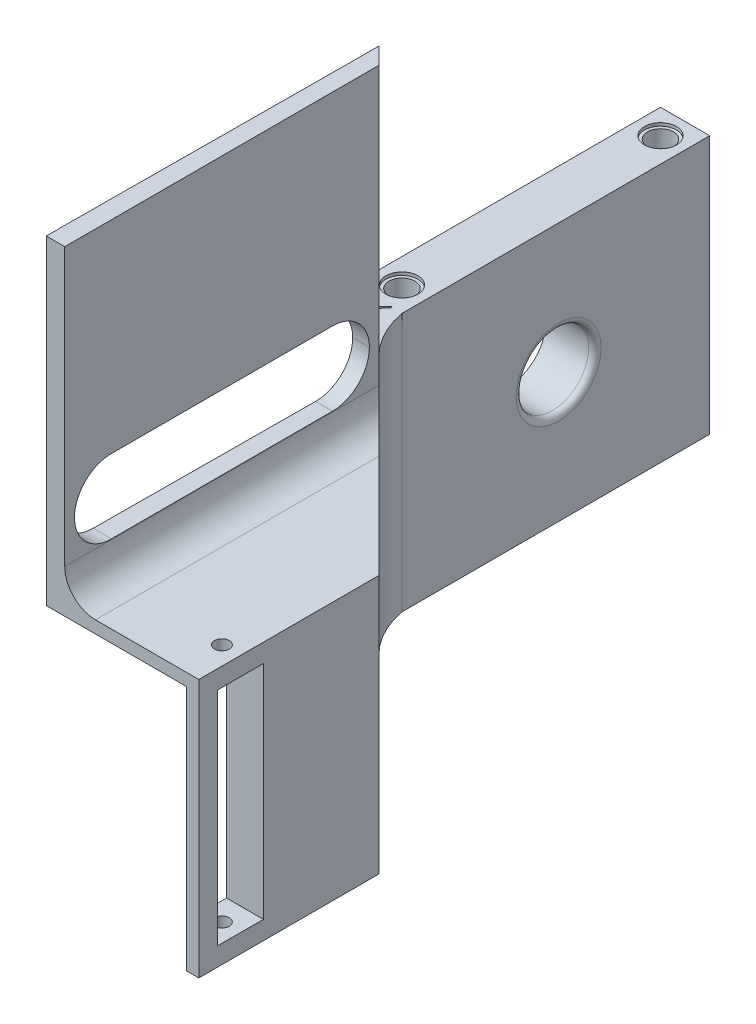
from build123d import *

# Parameters (mm, degrees)
SKETCH1_W           = 25
SKETCH1_H           = 50
SKETCH1_R           = 3.4
BOSS_EXTRUDE1_DEPTH = 3
SKETCH2_W           = 50
SKETCH2_H           = 3
BOSS_EXTRUDE2_DEPTH = 8
SKETCH3_W           = 8
SKETCH3_H           = 50
BOSS_EXTRUDE3_DEPTH = 42
SKETCH4_R           = 2.65
CUT_EXTRUDE1_DEPTH  = 0.5
SKETCH5_R           = 5.888972746
CUT_EXTRUDE2_DEPTH  = 9
FILLET2_R           = 1
SKETCH6_R           = 12.6
BOSS_EXTRUDE4_DEPTH = 2
FILLET4_R           = 1
SKETCH8_R           = 1.589780168
SKETCH8_R_2         = 1.777428262
CUT_EXTRUDE3_DEPTH  = 10
SKETCH9_W           = 49.021678163
SKETCH9_H           = 20.976854622
CUT_EXTRUDE4_DEPTH  = 68.79439129
SKETCH11_R          = 2.1
CUT_EXTRUDE5_DEPTH  = 59.480168703
SKETCH14_R          = 2.6
CUT_EXTRUDE6_DEPTH  = 0.5
BOSS_EXTRUDE5_DEPTH = 42
FILLET5_R           = 15
BOSS_EXTRUDE6_DEPTH = 42
SKETCH18_W          = 7.5
SKETCH18_H          = 36
CUT_EXTRUDE7_DEPTH  = 8
SKETCH19_R          = 1.2
CUT_EXTRUDE8_DEPTH  = 96.073366415
FILL_START          = -24.41711757
FILL_PATTERN1_DEPTH = 4.904046836
CHAMFER1_SIZE       = 4
CUT_EXTRUDE9_DEPTH  = 96.073366415
BOSS_EXTRUDE7_DEPTH = 2
BOSS_EXTRUDE8_DEPTH = 50
BOSS_EXTRUDE9_DEPTH = 4
SKETCH24_W          = 47.897956882
SKETCH24_H          = 12
CUT_EXTRUDE10_DEPTH = 4
FILLET6_R           = 6
FILLET7_R           = 5


# Read off the part's stored shape, not the designer's step: Fill Pattern1
# Some blends are built 0.0001 mm under size
with BuildPart() as part:
    # Sketch1 → Boss-Extrude1 (new body)
    with BuildSketch(Plane(origin=(0, 0, 0), x_dir=(1, 0, 0), z_dir=(0, 1, 0))):
        with Locations((2.276951673, 11.384758364)):
            Rectangle(SKETCH1_W, SKETCH1_H)
        with Locations(Location((1.276951673, 11.384758364, 0), (0, 0, 270))):
            Circle(SKETCH1_R, mode=Mode.SUBTRACT)
    extrude(amount=BOSS_EXTRUDE1_DEPTH)

    # Sketch2 → Boss-Extrude2 (add)
    with BuildSketch(Plane.ZY.offset(10.223048327)):
        with Locations((-11.384758364, 1.5)):
            Rectangle(SKETCH2_W, SKETCH2_H)
    extrude(amount=BOSS_EXTRUDE2_DEPTH)

    # Sketch3 → Boss-Extrude3 (add)
    with BuildSketch(Plane.XZ):
        with Locations((-14.223048327, -11.384758364)):
            Rectangle(SKETCH3_W, SKETCH3_H)
    extrude(amount=BOSS_EXTRUDE3_DEPTH)

    # Sketch4 → Cut-Extrude1 (cut)
    with BuildSketch(Plane(origin=(0, 3, 0), x_dir=(1, 0, 0), z_dir=(0, 1, 0))):
        with Locations(Location((-14.223048327, 32.384758364, 0), (0, 0, 270))):
            Circle(SKETCH4_R)
        with Locations(Location((-14.223048327, -9.615241636, 0), (0, 0, 270))):
            Circle(SKETCH4_R)
    cut_extrude1 = extrude(amount=-CUT_EXTRUDE1_DEPTH, mode=Mode.SUBTRACT)

    # Mirror1: Cut-Extrude1 across plane
    add(cut_extrude1.mirror(Plane.ZX.offset(-19.5)), mode=Mode.SUBTRACT)

    # Sketch5 → Cut-Extrude2 (cut)
    with BuildSketch(Plane.ZY.offset(18.223048327)):
        with Locations((-11.836279124, -21)):
            Circle(SKETCH5_R)
    extrude(amount=-CUT_EXTRUDE2_DEPTH, mode=Mode.SUBTRACT)

    # Fillet2
    fillet2_edges = [part.edges().sort_by_distance(p)[0] for p in [
        (-10.223048327, -21, -17.72525187),
    ]]
    fillet(fillet2_edges, radius=FILLET2_R)

    # Mirror2: Cut-Extrude1 across plane
    add(cut_extrude1.mirror(Plane.ZY.offset(1.723048327)), mode=Mode.SUBTRACT)

    # Sketch6 → Boss-Extrude4 (add)
    with BuildSketch(Plane(origin=(0, 3, 0), x_dir=(1, 0, 0), z_dir=(0, 1, 0))):
        with BuildLine():
            Line((14.776951673, 5.825082115), (14.776951673, 16.944434614))
            ThreePointArc((14.776951673, 16.944434614), (-13.323048327, 11.384758364), (14.776951673, 5.825082115))
        make_face()
        with Locations(Location((1.276951673, 11.384758364, 0), (0, 0, 270))):
            Circle(SKETCH6_R, mode=Mode.SUBTRACT)
    extrude(amount=BOSS_EXTRUDE4_DEPTH)

    # Fillet4
    # the kernel refuses this fillet: 1 mm, written as the material it takes off along each edge
    with BuildSketch(Plane(origin=(14.776951673, 5, -3.325082115), x_dir=(0, -1, 0), z_dir=(0, 0, -1))) as fillet4_piece_1:
        with BuildLine():
            CenterArc((FILLET4_R, FILLET4_R), FILLET4_R, 180, 90)
            Line((0, FILLET4_R), (0, 0))
            Line((0, 0), (FILLET4_R, 0))
        make_face()
    extrude(amount=16.119352499, mode=Mode.SUBTRACT)

    # Sketch8 → Cut-Extrude3 (cut)
    with BuildSketch(Plane(origin=(0, 3, 0), x_dir=(1, 0, 0), z_dir=(0, 1, 0))):
        with Locations(Location((1.276951673, 19.884758364, 0), (0, 0, 270))):
            Circle(SKETCH8_R)
        with Locations(Location((1.276951673, 2.884758364, 0), (0, 0, 270))):
            Circle(SKETCH8_R_2)
    extrude(amount=-CUT_EXTRUDE3_DEPTH, mode=Mode.SUBTRACT)

    # Sketch9 → Cut-Extrude4 (cut, through all)
    with BuildSketch(Plane.XY.offset(13.615241636)):
        with Locations((-9.733887409, 10.488427311)):
            Rectangle(SKETCH9_W, SKETCH9_H)
    extrude(amount=-CUT_EXTRUDE4_DEPTH, mode=Mode.SUBTRACT)

    # Sketch11 → Cut-Extrude5 (cut, through all)
    with BuildSketch(Plane(origin=(0, 0, 0), x_dir=(1, 0, 0), z_dir=(0, 1, 0))):
        with Locations(Location((-14.223048327, 32.384758364, 0), (0, 0, 270))):
            Circle(SKETCH11_R)
    cut_extrude5 = extrude(amount=-CUT_EXTRUDE5_DEPTH, mode=Mode.SUBTRACT)

    # Mirror3: Cut-Extrude5 across plane
    add(cut_extrude5.mirror(Plane.XY.offset(-11.384758364)), mode=Mode.SUBTRACT)

    # Sketch14 → Cut-Extrude6 (cut)
    with BuildSketch(Plane(origin=(0, 0, 0), x_dir=(1, 0, 0), z_dir=(0, 1, 0))):
        with Locations(Location((-14.223048327, -9.615241636, 0), (0, 0, 270))):
            Circle(SKETCH14_R)
    cut_extrude6 = extrude(amount=-CUT_EXTRUDE6_DEPTH, mode=Mode.SUBTRACT)

    # Mirror4: Cut-Extrude6 across plane
    add(cut_extrude6.mirror(Plane.XY.offset(-11.384758364)), mode=Mode.SUBTRACT)

    # Sketch16 → Boss-Extrude5 (add)
    with BuildSketch(Plane(origin=(0, 0, 0), x_dir=(1, 0, 0), z_dir=(0, 1, 0))):
        Polygon((-18.223048327, -13.615241636), (24.776951673, -56.615241636), (24.776951673, -52.372600949), (-13.98040764, -13.615241636), align=None)
    extrude(amount=-BOSS_EXTRUDE5_DEPTH)

    # Fillet5
    # the kernel refuses this fillet: 15 mm, written as the material it adds along each edge
    with BuildSketch(Plane(origin=(-13.98040764, 0, 13.615241636), x_dir=(1, 0, 0), z_dir=(0, -1, 0))) as fillet5_piece_1:
        with BuildLine():
            CenterArc((18.512169169, -2.701034267), FILLET5_R, 135, 34.626223963)
            Line((7.905567451, 7.905567451), (0, 0))
            Line((0, 0), (3.757359313, 0))
        make_face()
    extrude(amount=42)

    # Sketch17 → Boss-Extrude6 (add)
    with BuildSketch(Plane(origin=(0, 0, 0), x_dir=(1, 0, 0), z_dir=(0, 1, 0))):
        Polygon((24.776951673, -56.615241636), (24.776951673, -81.615241636), (18.776951673, -81.615241636), (18.776951673, -50.615241636), align=None)
    extrude(amount=-BOSS_EXTRUDE6_DEPTH)

    # Sketch18 → Cut-Extrude7 (cut)
    with BuildSketch(Plane(origin=(24.776951673, 0, 0), x_dir=(0, 0, -1), z_dir=(1, 0, 0))):
        with Locations((-74.865241636, -21)):
            Rectangle(SKETCH18_W, SKETCH18_H)
    extrude(amount=-CUT_EXTRUDE7_DEPTH, mode=Mode.SUBTRACT)

    # Sketch19 → Cut-Extrude8 (cut, through all)
    with BuildSketch(Plane(origin=(0, 0, 0), x_dir=(1, 0, 0), z_dir=(0, 1, 0))):
        with Locations(Location((21.776951673, -74.865241636, 0), (0, 0, 270))):
            Circle(SKETCH19_R)
    extrude(amount=-CUT_EXTRUDE8_DEPTH, mode=Mode.SUBTRACT)

    # Fill Pattern1 outline → Fill Pattern1 (cut)
    with BuildSketch(Plane(origin=(0, 0, 0), x_dir=(0.7071067811865468, 0, 0.7071067811865482), z_dir=(0.7071067811865481, 0, -0.707106781186547)).offset(FILL_START)):
        Polygon((45.971737286, 5.859685187), (47.221737286, 3.694621678), (49.721737286, 3.694621678), (50.971737286, 5.859685187), (49.721737286, 8.024748697), (47.221737286, 8.024748697), align=None)
        Polygon((30.237460587, 33.11225185), (31.487460587, 30.947188341), (33.987460587, 30.947188341), (35.237460587, 33.11225185), (33.987460587, 35.27731536), (31.487460587, 35.27731536), align=None)
        Polygon((40.726978386, 14.943874075), (41.976978386, 12.778810565), (44.476978386, 12.778810565), (45.726978386, 14.943874075), (44.476978386, 17.108937584), (41.976978386, 17.108937584), align=None)
        Polygon((35.482219487, 24.028062963), (36.732219487, 21.862999453), (39.232219487, 21.862999453), (40.482219487, 24.028062963), (39.232219487, 26.193126472), (36.732219487, 26.193126472), align=None)
        Polygon((15.753183888, 3.694621678), (18.253183888, 3.694621678), (19.503183888, 5.859685187), (18.253183888, 8.024748697), (15.753183888, 8.024748697), (14.503183888, 5.859685187), align=None)
        Polygon((26.242701687, 3.694621678), (28.742701687, 3.694621678), (29.992701687, 5.859685187), (28.742701687, 8.024748697), (26.242701687, 8.024748697), (24.992701687, 5.859685187), align=None)
        Polygon((36.732219487, 3.694621678), (39.232219487, 3.694621678), (40.482219487, 5.859685187), (39.232219487, 8.024748697), (36.732219487, 8.024748697), (35.482219487, 5.859685187), align=None)
        Polygon((45.971737286, 11.915811112), (47.221737286, 9.750747603), (49.721737286, 9.750747603), (50.971737286, 11.915811112), (49.721737286, 14.080874622), (47.221737286, 14.080874622), align=None)
        Polygon((40.726978386, 21), (41.976978386, 18.834936491), (44.476978386, 18.834936491), (45.726978386, 21), (44.476978386, 23.165063509), (41.976978386, 23.165063509), align=None)
        Polygon((35.482219487, 30.084188888), (36.732219487, 27.919125378), (39.232219487, 27.919125378), (40.482219487, 30.084188888), (39.232219487, 32.249252397), (36.732219487, 32.249252397), align=None)
        Polygon((15.753183888, 9.750747603), (18.253183888, 9.750747603), (19.503183888, 11.915811112), (18.253183888, 14.080874622), (15.753183888, 14.080874622), (14.503183888, 11.915811112), align=None)
        Polygon((26.242701687, 9.750747603), (28.742701687, 9.750747603), (29.992701687, 11.915811112), (28.742701687, 14.080874622), (26.242701687, 14.080874622), (24.992701687, 11.915811112), align=None)
        Polygon((36.732219487, 9.750747603), (39.232219487, 9.750747603), (40.482219487, 11.915811112), (39.232219487, 14.080874622), (36.732219487, 14.080874622), (35.482219487, 11.915811112), align=None)
        Polygon((45.971737286, 17.971937037), (47.221737286, 15.806873528), (49.721737286, 15.806873528), (50.971737286, 17.971937037), (49.721737286, 20.137000547), (47.221737286, 20.137000547), align=None)
        Polygon((40.726978386, 27.056125925), (41.976978386, 24.891062416), (44.476978386, 24.891062416), (45.726978386, 27.056125925), (44.476978386, 29.221189435), (41.976978386, 29.221189435), align=None)
        Polygon((35.482219487, 36.140314813), (36.732219487, 33.975251303), (39.232219487, 33.975251303), (40.482219487, 36.140314813), (39.232219487, 38.305378322), (36.732219487, 38.305378322), align=None)
        Polygon((15.753183888, 15.806873528), (18.253183888, 15.806873528), (19.503183888, 17.971937037), (18.253183888, 20.137000547), (15.753183888, 20.137000547), (14.503183888, 17.971937037), align=None)
        Polygon((26.242701687, 15.806873528), (28.742701687, 15.806873528), (29.992701687, 17.971937037), (28.742701687, 20.137000547), (26.242701687, 20.137000547), (24.992701687, 17.971937037), align=None)
        Polygon((36.732219487, 15.806873528), (39.232219487, 15.806873528), (40.482219487, 17.971937037), (39.232219487, 20.137000547), (36.732219487, 20.137000547), (35.482219487, 17.971937037), align=None)
        Polygon((44.476978386, 6.72268464), (45.726978386, 8.88774815), (44.476978386, 11.052811659), (41.976978386, 11.052811659), (40.726978386, 8.88774815), (41.976978386, 6.72268464), align=None)
        Polygon((45.971737286, 24.028062963), (47.221737286, 21.862999453), (49.721737286, 21.862999453), (50.971737286, 24.028062963), (49.721737286, 26.193126472), (47.221737286, 26.193126472), align=None)
        Polygon((40.726978386, 33.11225185), (41.976978386, 30.947188341), (44.476978386, 30.947188341), (45.726978386, 33.11225185), (44.476978386, 35.27731536), (41.976978386, 35.27731536), align=None)
        Polygon((15.753183888, 21.862999453), (18.253183888, 21.862999453), (19.503183888, 24.028062963), (18.253183888, 26.193126472), (15.753183888, 26.193126472), (14.503183888, 24.028062963), align=None)
        Polygon((26.242701687, 21.862999453), (28.742701687, 21.862999453), (29.992701687, 24.028062963), (28.742701687, 26.193126472), (26.242701687, 26.193126472), (24.992701687, 24.028062963), align=None)
        Polygon((45.971737286, 36.140314813), (47.221737286, 33.975251303), (49.721737286, 33.975251303), (50.971737286, 36.140314813), (49.721737286, 38.305378322), (47.221737286, 38.305378322), align=None)
        Polygon((15.753183888, 33.975251303), (18.253183888, 33.975251303), (19.503183888, 36.140314813), (18.253183888, 38.305378322), (15.753183888, 38.305378322), (14.503183888, 36.140314813), align=None)
        Polygon((26.242701687, 33.975251303), (28.742701687, 33.975251303), (29.992701687, 36.140314813), (28.742701687, 38.305378322), (26.242701687, 38.305378322), (24.992701687, 36.140314813), align=None)
        Polygon((33.987460587, 6.72268464), (35.237460587, 8.88774815), (33.987460587, 11.052811659), (31.487460587, 11.052811659), (30.237460587, 8.88774815), (31.487460587, 6.72268464), align=None)
        Polygon((45.971737286, 30.084188888), (47.221737286, 27.919125378), (49.721737286, 27.919125378), (50.971737286, 30.084188888), (49.721737286, 32.249252397), (47.221737286, 32.249252397), align=None)
        Polygon((15.753183888, 27.919125378), (18.253183888, 27.919125378), (19.503183888, 30.084188888), (18.253183888, 32.249252397), (15.753183888, 32.249252397), (14.503183888, 30.084188888), align=None)
        Polygon((26.242701687, 27.919125378), (28.742701687, 27.919125378), (29.992701687, 30.084188888), (28.742701687, 32.249252397), (26.242701687, 32.249252397), (24.992701687, 30.084188888), align=None)
        Polygon((19.747942788, 27.056125925), (20.997942788, 24.891062416), (23.497942788, 24.891062416), (24.747942788, 27.056125925), (23.497942788, 29.221189435), (20.997942788, 29.221189435), align=None)
        Polygon((19.747942788, 8.88774815), (20.997942788, 6.72268464), (23.497942788, 6.72268464), (24.747942788, 8.88774815), (23.497942788, 11.052811659), (20.997942788, 11.052811659), align=None)
        Polygon((33.987460587, 24.891062416), (35.237460587, 27.056125925), (33.987460587, 29.221189435), (31.487460587, 29.221189435), (30.237460587, 27.056125925), (31.487460587, 24.891062416), align=None)
        Polygon((19.747942788, 14.943874075), (20.997942788, 12.778810565), (23.497942788, 12.778810565), (24.747942788, 14.943874075), (23.497942788, 17.108937584), (20.997942788, 17.108937584), align=None)
        Polygon((31.487460587, 12.778810565), (33.987460587, 12.778810565), (35.237460587, 14.943874075), (33.987460587, 17.108937584), (31.487460587, 17.108937584), (30.237460587, 14.943874075), align=None)
        Polygon((19.747942788, 21), (20.997942788, 18.834936491), (23.497942788, 18.834936491), (24.747942788, 21), (23.497942788, 23.165063509), (20.997942788, 23.165063509), align=None)
        Polygon((31.487460587, 18.834936491), (33.987460587, 18.834936491), (35.237460587, 21), (33.987460587, 23.165063509), (31.487460587, 23.165063509), (30.237460587, 21), align=None)
        Polygon((20.997942788, 30.947188341), (23.497942788, 30.947188341), (24.747942788, 33.11225185), (23.497942788, 35.27731536), (20.997942788, 35.27731536), (19.747942788, 33.11225185), align=None)
    extrude(amount=FILL_PATTERN1_DEPTH, mode=Mode.SUBTRACT)

    # Chamfer1
    # the kernel refuses this chamfer: 4 mm, written as the material it takes off along each edge
    with BuildSketch(Plane(origin=(18.776951673, 10.286731952, 81.615241636), x_dir=(0.9996219169112968, 0, 0.027495876610585623), z_dir=(0, -1, 0))) as chamfer1_piece_1:
        Polygon((CHAMFER1_SIZE * 0.999621916911, -CHAMFER1_SIZE * 0.0274958766106), (-CHAMFER1_SIZE * 0.0274958766106, -CHAMFER1_SIZE * 0.999621916911), (0, 0), align=None)
    extrude(amount=62.573463904, mode=Mode.SUBTRACT)

    # Sketch20 → Cut-Extrude9 (cut, through all)
    with BuildSketch(Plane(origin=(0, 0, 0), x_dir=(1, 0, 0), z_dir=(0, 1, 0))):
        Polygon((-12.007369699, -13.422049918), (-13.646299524, -15.19356362), (-10.796749548, -17.829847178), (-10.525107778, -17.536230508), (-13.131913788, -15.124523438), (-11.876337797, -13.743390342), align=None)
    extrude(amount=-CUT_EXTRUDE9_DEPTH, mode=Mode.SUBTRACT)

    # Sketch21 → Boss-Extrude7 (add)
    with BuildSketch(Plane(origin=(0, 0, 0), x_dir=(1, 0, 0), z_dir=(0, 1, 0))):
        Polygon((18.776951673, -77.615241636), (0, -77.615241636), (0.276951673, -32.115241636), (18.776951673, -50.615241636), align=None)
    extrude(amount=-BOSS_EXTRUDE7_DEPTH)

    # Sketch22 → Boss-Extrude8 (add)
    with BuildSketch(Plane(origin=(0, 0, 0), x_dir=(1, 0, 0), z_dir=(0, 1, 0))):
        Polygon((0, -77.615241636), (0.276951673, -32.115241636), (0.276951673, -27.872600949), (3, -30.595649276), (3, -77.615241636), align=None)
    extrude(amount=BOSS_EXTRUDE8_DEPTH)

    # Sketch23 → Boss-Extrude9 (add)
    with BuildSketch(Plane.XY.offset(81.615241636)):
        Polygon((22.776951673, 0), (3, 0), (3, 50), (0, 50), (0, -2), (22.776951673, -2), align=None)
    extrude(amount=-BOSS_EXTRUDE9_DEPTH)

    # Sketch24 → Cut-Extrude10 (cut)
    with BuildSketch(Plane(origin=(0.472414827, 0, 0.002875518), x_dir=(-0.006086737198043909, 0, 0.9999814756435651), z_dir=(-0.9999814756435652, 0, -0.0060867371980439094))):
        with Locations((56.06193943, 11.100904833)):
            Rectangle(SKETCH24_W, SKETCH24_H)
    extrude(amount=-CUT_EXTRUDE10_DEPTH, mode=Mode.SUBTRACT)

    # Fillet6
    fillet6_edges = [part.edges().sort_by_distance(p)[0] for p in [
        (1.5, 5.100904833, 80.021530325),
        (1.5, 17.100904833, 80.021530325),
        (1.638475836, 17.100904833, 32.123529029),
        (1.638475836, 5.100904833, 32.123529029),
    ]]
    fillet(fillet6_edges, radius=FILLET6_R - 0.0001)  # a hair under: the kernel refuses the full size

    # Fillet7
    fillet7_edges = [part.edges().sort_by_distance(p)[0] for p in [
        (3, 0, 56.105445456),
    ]]
    fillet(fillet7_edges, radius=FILLET7_R)


solid = part.part
